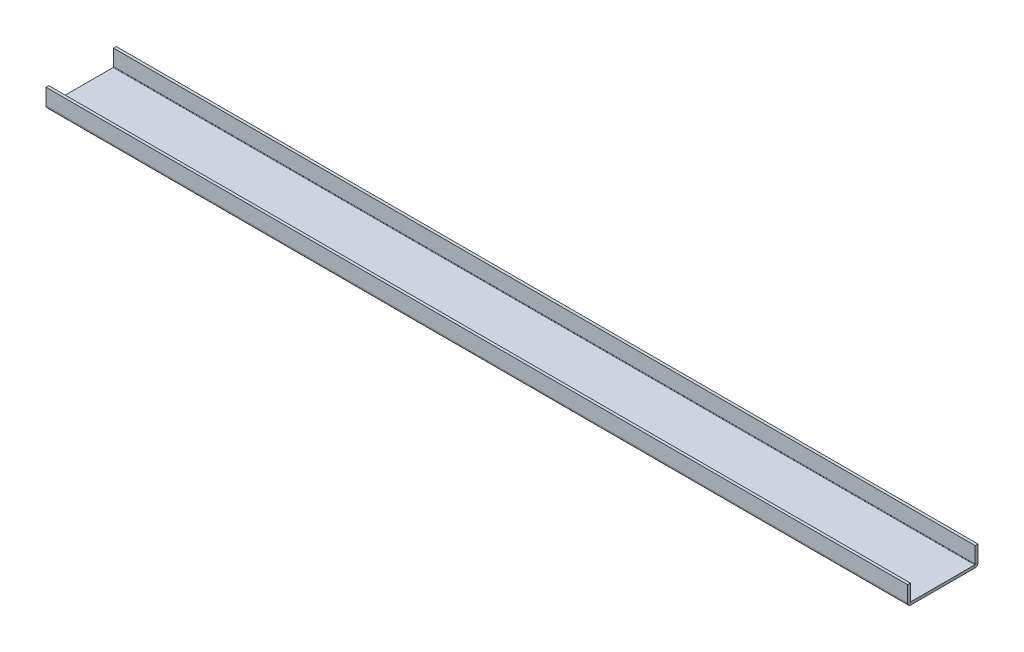
from build123d import *

# Parameters (mm, degrees)
BASE_FLANGE1_DEPTH = 431.8


# Sheet-metal steps are written as plain solids
with BuildPart() as part:
    # Sketch1 → Base-Flange1 (new body)
    with BuildSketch(Plane(origin=(0, 0, 0), x_dir=(0, 0, -1), z_dir=(1, 0, 0))):
        with BuildLine():
            Line((0, 8.25), (0, 0.25))
            ThreePointArc((0, 0.25), (0.073223305, 0.073223305), (0.25, 0))
            Line((0.25, 0), (32.25, 0))
            ThreePointArc((32.25, 0), (32.426776695, 0.073223305), (32.5, 0.25))
            Line((32.5, 0.25), (32.5, 8.25))
            Line((32.5, 8.25), (33.9, 8.25))
            Line((33.9, 8.25), (33.9, 0.25))
            ThreePointArc((33.9, 0.25), (33.416726189, -0.916726189), (32.25, -1.4))
            Line((32.25, -1.4), (0.25, -1.4))
            ThreePointArc((0.25, -1.4), (-0.916726189, -0.916726189), (-1.4, 0.25))
            Line((-1.4, 0.25), (-1.4, 8.25))
            Line((-1.4, 8.25), (0, 8.25))
        make_face()
    extrude(amount=BASE_FLANGE1_DEPTH)


solid = part.part
